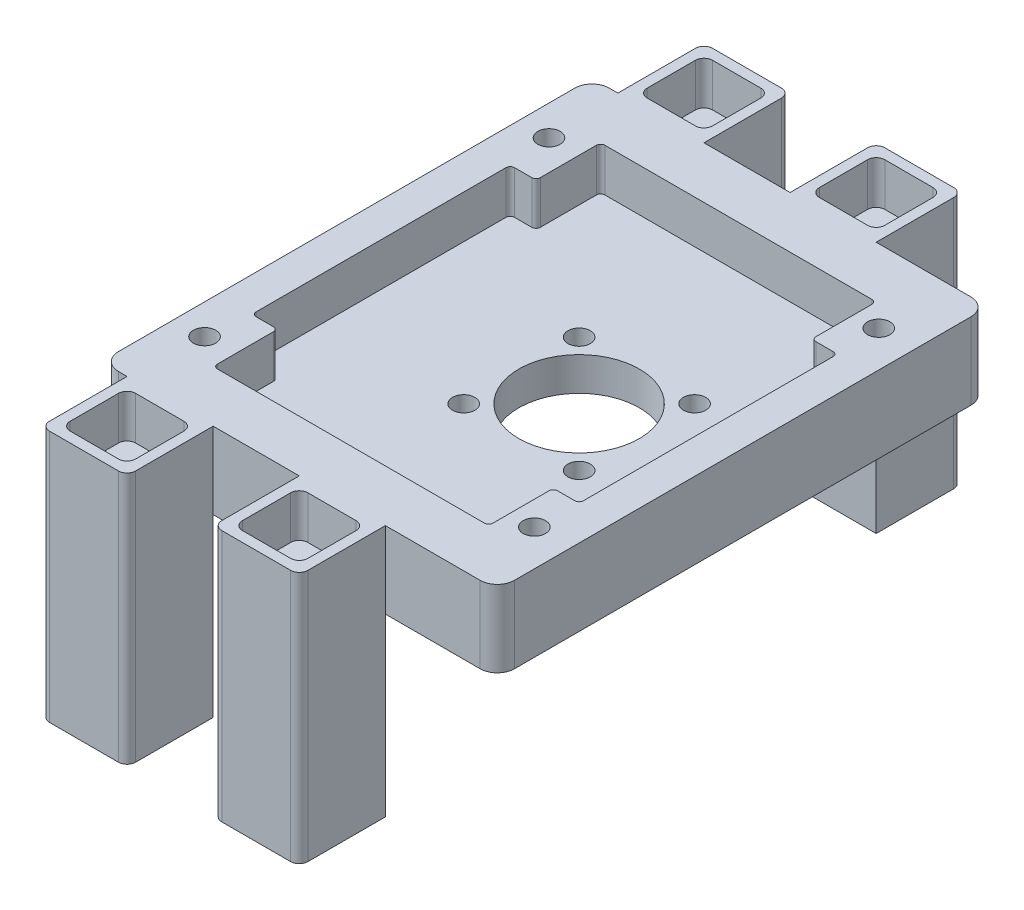
from build123d import *

# Parameters (mm, degrees)
SKETCH1_R            = 7
BOSS_EXTRUDE1_DEPTH  = 8.9
CUT_EXTRUDE1_REACH   = 42.255
SKETCH6_R            = 1.3
CIRPATTERN1_COUNT    = 4
CUT_EXTRUDE2_REACH   = 42.255
SKETCH7_R            = 1.3
CUT_EXTRUDE3_DEPTH   = 5
SKETCH10_W           = 10
SKETCH10_H           = 8.9
BOSS_EXTRUDE2_DEPTH  = 10
SKETCH11_W           = 10
SKETCH11_H           = 10
BOSS_EXTRUDE3_DEPTH  = 20.4
SKETCH12_W           = 7.6
SKETCH12_H           = 7.6
CUT_EXTRUDE4_DEPTH   = 5
CUT_EXTRUDE5_REACH   = 54.931
SKETCH13_R           = 1.7
FILLET1_R            = 1
FILLET1_OF_MIRROR2_R = 1
MIRROR3_START        = -20.4
MIRROR3_OUTLINE_R    = 1.7
MIRROR3_DEPTH        = 24.3
MIRROR3_START_2      = 3.9
MIRROR3_2_DEPTH      = 5
FILLET2_R            = 0.5


# Read off the part's stored shape, not the designer's step: Mirror3
with BuildPart() as part:
    # Sketch1 → Boss-Extrude1 (new body)
    with BuildSketch(Plane(origin=(0, 0, 0), x_dir=(1, 0, 0), z_dir=(0, 1, 0))):
        with BuildLine():
            Line((-25, -28.5), (17, -28.5))
            ThreePointArc((17, -28.5), (18.414213562, -27.914213562), (19, -26.5))
            Line((19, -26.5), (19, 26.5))
            ThreePointArc((19, 26.5), (18.414213562, 27.914213562), (17, 28.5))
            Line((17, 28.5), (-25, 28.5))
            ThreePointArc((-25, 28.5), (-26.414213562, 27.914213562), (-27, 26.5))
            Line((-27, 26.5), (-27, -26.5))
            ThreePointArc((-27, -26.5), (-26.414213562, -27.914213562), (-25, -28.5))
        make_face()
        with Locations(Location((0, 0, 0), (0, 0, 270))):
            Circle(SKETCH1_R, mode=Mode.SUBTRACT)
    extrude(amount=BOSS_EXTRUDE1_DEPTH)

    # Sketch6 → Cut-Extrude1 (cut, up to next)
    with BuildSketch(Plane(origin=(0, 8.9, 0), x_dir=(1, 0, 0), z_dir=(0, 1, 0)), mode=Mode.PRIVATE) as cut_extrude1_sk1:
        with Locations(Location((-6.703372286, -6.703372286, 0), (0, 0, 270))):
            Circle(SKETCH6_R)
    cut_extrude1_tool1 = extrude(cut_extrude1_sk1.sketch, amount=-CUT_EXTRUDE1_REACH, mode=Mode.PRIVATE) & part.part
    cut_extrude1 = cut_extrude1_tool1.solids().sort_by_distance((-6.703372, 8.9, 6.703372))[0]
    add(cut_extrude1, mode=Mode.SUBTRACT)

    # CirPattern1: Cut-Extrude1 ×4 about axis
    cirpattern1_axis = Axis((0, 0, 0), (0, 1, 0))
    for i in range(1, CIRPATTERN1_COUNT):
        add(cut_extrude1.rotate(cirpattern1_axis, i * 360 / CIRPATTERN1_COUNT), mode=Mode.SUBTRACT)

    # Sketch7 → Cut-Extrude2 (cut, up to next)
    with BuildSketch(Plane(origin=(0, 8.9, 0), x_dir=(1, 0, 0), z_dir=(0, 1, 0)), mode=Mode.PRIVATE) as cut_extrude2_sk1:
        with Locations(Location((-23.5, -20, 0), (0, 0, 270))):
            Circle(SKETCH7_R)
    cut_extrude2_tool1 = extrude(cut_extrude2_sk1.sketch, amount=-CUT_EXTRUDE2_REACH, mode=Mode.PRIVATE) & part.part
    # Sketch7 → Cut-Extrude2 (cut, up to next)
    with BuildSketch(Plane(origin=(0, 8.9, 0), x_dir=(1, 0, 0), z_dir=(0, 1, 0)), mode=Mode.PRIVATE) as cut_extrude2_sk2:
        with Locations(Location((-23.5, 20, 0), (0, 0, 270))):
            Circle(SKETCH7_R)
    cut_extrude2_tool2 = extrude(cut_extrude2_sk2.sketch, amount=-CUT_EXTRUDE2_REACH, mode=Mode.PRIVATE) & part.part
    # Sketch7 → Cut-Extrude2 (cut, up to next)
    with BuildSketch(Plane(origin=(0, 8.9, 0), x_dir=(1, 0, 0), z_dir=(0, 1, 0)), mode=Mode.PRIVATE) as cut_extrude2_sk3:
        with Locations(Location((14.8, -20, 0), (0, 0, 270))):
            Circle(SKETCH7_R)
    cut_extrude2_tool3 = extrude(cut_extrude2_sk3.sketch, amount=-CUT_EXTRUDE2_REACH, mode=Mode.PRIVATE) & part.part
    # Sketch7 → Cut-Extrude2 (cut, up to next)
    with BuildSketch(Plane(origin=(0, 8.9, 0), x_dir=(1, 0, 0), z_dir=(0, 1, 0)), mode=Mode.PRIVATE) as cut_extrude2_sk4:
        with Locations(Location((14.8, 20, 0), (0, 0, 270))):
            Circle(SKETCH7_R)
    cut_extrude2_tool4 = extrude(cut_extrude2_sk4.sketch, amount=-CUT_EXTRUDE2_REACH, mode=Mode.PRIVATE) & part.part
    add(cut_extrude2_tool1.solids().sort_by_distance((-23.5, 8.9, 20))[0], mode=Mode.SUBTRACT)
    add(cut_extrude2_tool2.solids().sort_by_distance((-23.5, 8.9, -20))[0], mode=Mode.SUBTRACT)
    add(cut_extrude2_tool3.solids().sort_by_distance((14.8, 8.9, 20))[0], mode=Mode.SUBTRACT)
    add(cut_extrude2_tool4.solids().sort_by_distance((14.8, 8.9, -20))[0], mode=Mode.SUBTRACT)

    # Sketch8 → Cut-Extrude3 (cut)
    with BuildSketch(Plane(origin=(0, 8.9, 0), x_dir=(1, 0, 0), z_dir=(0, 1, 0))):
        Polygon((-20, -15), (-20, -22.5), (12, -22.5), (12, -15), (15, -15), (15, 15), (12, 15), (12, 22.5), (-20, 22.5), (-20, 15), (-23, 15), (-23, -15), align=None)
    extrude(amount=-CUT_EXTRUDE3_DEPTH, mode=Mode.SUBTRACT)

    # Sketch10 → Boss-Extrude2 (add)
    with BuildSketch(Plane.XY.offset(28.5)):
        with Locations((-19, 4.45)):
            Rectangle(SKETCH10_W, SKETCH10_H)
    boss_extrude2 = extrude(amount=BOSS_EXTRUDE2_DEPTH)

    # Sketch11 → Boss-Extrude3 (add)
    with BuildSketch(Plane.XZ):
        with Locations((-19, 33.5)):
            Rectangle(SKETCH11_W, SKETCH11_H)
    boss_extrude3 = extrude(amount=BOSS_EXTRUDE3_DEPTH)

    # Sketch12 → Cut-Extrude4 (cut)
    with BuildSketch(Plane(origin=(0, 8.9, 0), x_dir=(1, 0, 0), z_dir=(0, 1, 0))):
        with Locations((-19, -33.5)):
            Rectangle(SKETCH12_W, SKETCH12_H)
    cut_extrude4 = extrude(amount=-CUT_EXTRUDE4_DEPTH, mode=Mode.SUBTRACT)

    # Sketch13 → Cut-Extrude5 (cut, up to next)
    with BuildSketch(Plane(origin=(0, 3.9, 0), x_dir=(1, 0, 0), z_dir=(0, 1, 0)), mode=Mode.PRIVATE) as cut_extrude5_sk1:
        with Locations(Location((-19, -33.5, 0), (0, 0, 270))):
            Circle(SKETCH13_R)
    cut_extrude5_tool1 = extrude(cut_extrude5_sk1.sketch, amount=-CUT_EXTRUDE5_REACH, mode=Mode.PRIVATE) & part.part
    cut_extrude5 = cut_extrude5_tool1.solids().sort_by_distance((-19, 3.9, 33.5))[0]
    add(cut_extrude5, mode=Mode.SUBTRACT)

    # Fillet1
    fillet1_edges = [part.edges().sort_by_distance(p)[0] for p in [
        (-24, -5.75, 38.5),
        (-14, -5.75, 38.5),
        (-22.8, 6.4, 29.7),
        (-22.8, 6.4, 37.3),
        (-15.2, 6.4, 37.3),
        (-15.2, 6.4, 29.7),
    ]]
    fillet(fillet1_edges, radius=FILLET1_R)

    # Mirror2: Boss-Extrude2, Boss-Extrude3, Cut-Extrude4, Cut-Extrude5 across plane
    add(boss_extrude2.mirror(Plane.ZY.offset(9)))
    add(boss_extrude3.mirror(Plane.ZY.offset(9)))
    add(cut_extrude4.mirror(Plane.ZY.offset(9)), mode=Mode.SUBTRACT)
    add(cut_extrude5.mirror(Plane.ZY.offset(9)), mode=Mode.SUBTRACT)

    # Fillet1 of Mirror2
    fillet1_of_mirror2_edges = [part.edges().sort_by_distance(p)[0] for p in [
        (6, -5.75, 38.5),
        (-4, -5.75, 38.5),
        (4.8, 6.4, 29.7),
        (4.8, 6.4, 37.3),
        (-2.8, 6.4, 37.3),
        (-2.8, 6.4, 29.7),
    ]]
    fillet(fillet1_of_mirror2_edges, radius=FILLET1_OF_MIRROR2_R)

    # Mirror3 outline → Mirror3 (add)
    # profile 1 of 2: a face of its own
    with BuildSketch(Plane(origin=(0, 0, 0), x_dir=(1, 0, 0), z_dir=(0, 1, 0)).offset(MIRROR3_START)):
        with BuildLine():
            ThreePointArc((-23, 38.5), (-23.707106781, 38.207106781), (-24, 37.5))
            Line((-24, 37.5), (-24, 28.5))
            Line((-24, 28.5), (-14, 28.5))
            Line((-14, 28.5), (-14, 37.5))
            ThreePointArc((-14, 37.5), (-14.292893219, 38.207106781), (-15, 38.5))
            Line((-15, 38.5), (-23, 38.5))
        make_face()
        with Locations((-19, 33.5)):
            Circle(MIRROR3_OUTLINE_R, mode=Mode.SUBTRACT)
    # profile 2 of 2: a face of its own
    with BuildSketch(Plane(origin=(0, 0, 0), x_dir=(1, 0, 0), z_dir=(0, 1, 0)).offset(MIRROR3_START)):
        with BuildLine():
            Line((-4, 37.5), (-4, 28.5))
            Line((-4, 28.5), (6, 28.5))
            Line((6, 28.5), (6, 37.5))
            ThreePointArc((6, 37.5), (5.707106781, 38.207106781), (5, 38.5))
            Line((5, 38.5), (-3, 38.5))
            ThreePointArc((-3, 38.5), (-3.707106781, 38.207106781), (-4, 37.5))
        make_face()
        with Locations((1, 33.5)):
            Circle(MIRROR3_OUTLINE_R, mode=Mode.SUBTRACT)
    extrude(amount=MIRROR3_DEPTH)

    # Mirror3 2 outline → Mirror3 2 (add)
    # profile 1 of 2: a face of its own
    with BuildSketch(Plane(origin=(0, 0, 0), x_dir=(1, 0, 0), z_dir=(0, 1, 0)).offset(MIRROR3_START_2)):
        with BuildLine():
            ThreePointArc((-23, 38.5), (-23.707106781, 38.207106781), (-24, 37.5))
            Line((-24, 37.5), (-24, 28.5))
            Line((-24, 28.5), (-14, 28.5))
            Line((-14, 28.5), (-14, 37.5))
            ThreePointArc((-14, 37.5), (-14.292893219, 38.207106781), (-15, 38.5))
            Line((-15, 38.5), (-23, 38.5))
        make_face()
        with BuildLine():
            ThreePointArc((-21.8, 29.7), (-22.507106781, 29.992893219), (-22.8, 30.7))
            Line((-22.8, 30.7), (-22.8, 36.3))
            ThreePointArc((-22.8, 36.3), (-22.507106781, 37.007106781), (-21.8, 37.3))
            Line((-21.8, 37.3), (-16.2, 37.3))
            ThreePointArc((-16.2, 37.3), (-15.492893219, 37.007106781), (-15.2, 36.3))
            Line((-15.2, 36.3), (-15.2, 30.7))
            ThreePointArc((-15.2, 30.7), (-15.492893219, 29.992893219), (-16.2, 29.7))
            Line((-16.2, 29.7), (-21.8, 29.7))
        make_face(mode=Mode.SUBTRACT)
    # profile 2 of 2: a face of its own
    with BuildSketch(Plane(origin=(0, 0, 0), x_dir=(1, 0, 0), z_dir=(0, 1, 0)).offset(MIRROR3_START_2)):
        with BuildLine():
            Line((-4, 37.5), (-4, 28.5))
            Line((-4, 28.5), (6, 28.5))
            Line((6, 28.5), (6, 37.5))
            ThreePointArc((6, 37.5), (5.707106781, 38.207106781), (5, 38.5))
            Line((5, 38.5), (-3, 38.5))
            ThreePointArc((-3, 38.5), (-3.707106781, 38.207106781), (-4, 37.5))
        make_face()
        with BuildLine():
            Line((-2.8, 30.7), (-2.8, 36.3))
            ThreePointArc((-2.8, 36.3), (-2.507106781, 37.007106781), (-1.8, 37.3))
            Line((-1.8, 37.3), (3.8, 37.3))
            ThreePointArc((3.8, 37.3), (4.507106781, 37.007106781), (4.8, 36.3))
            Line((4.8, 36.3), (4.8, 30.7))
            ThreePointArc((4.8, 30.7), (4.507106781, 29.992893219), (3.8, 29.7))
            Line((3.8, 29.7), (-1.8, 29.7))
            ThreePointArc((-1.8, 29.7), (-2.507106781, 29.992893219), (-2.8, 30.7))
        make_face(mode=Mode.SUBTRACT)
    extrude(amount=MIRROR3_2_DEPTH)

    # Fillet2
    fillet2_edges = [part.edges().sort_by_distance(p)[0] for p in [
        (-23, 6.4, -15),
        (-20, 6.4, -15),
        (-20, 6.4, -22.5),
        (12, 6.4, -22.5),
        (12, 6.4, -15),
        (15, 6.4, -15),
        (15, 6.4, 15),
        (12, 6.4, 15),
        (12, 6.4, 22.5),
        (-20, 6.4, 22.5),
        (-20, 6.4, 15),
        (-23, 6.4, 15),
    ]]
    fillet(fillet2_edges, radius=FILLET2_R)


solid = part.part
